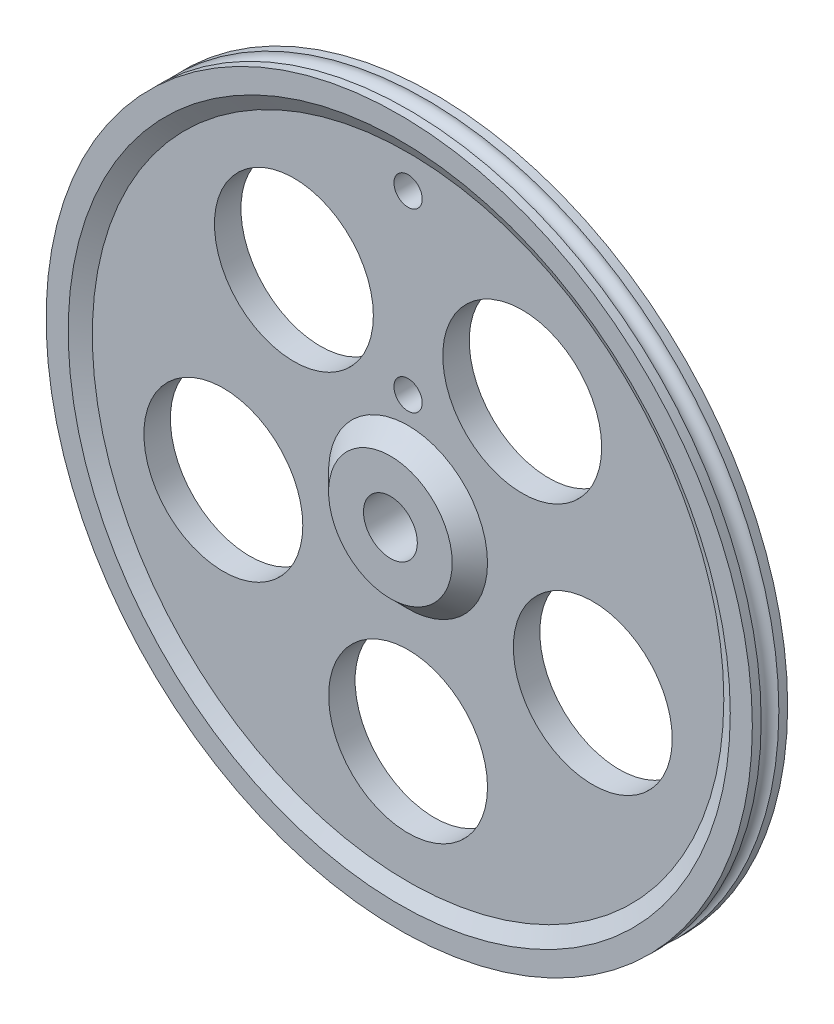
from build123d import *

# Parameters (mm, degrees)
SKETCH2_W          = 7
SKETCH2_H          = 1
SKETCH3_R          = 3.05
CUT_EXTRUDE1_DEPTH = 57.789083458
CHAMFER1_SIZE      = 2
SKETCH4_R          = 9
CUT_EXTRUDE2_DEPTH = 57.648036153
SKETCH5_R          = 1.6
CUT_EXTRUDE3_DEPTH = 57.789083458


with BuildPart() as part:
    # Sketch2 → Revolve1 (revolve)
    with BuildSketch(Plane(origin=(0, 0, 0), x_dir=(1, 0, 0), z_dir=(0, 1, 0))):
        with Locations((3.5, -2.5)):
            Rectangle(SKETCH2_W, SKETCH2_H)
        with BuildLine():
            Line((0, 2), (0, -2))
            Line((0, -2), (7, -2))
            Line((7, -2), (7, -1))
            Line((7, -1), (35.767949192, -1))
            Line((35.767949192, -1), (37.5, -2))
            Line((37.5, -2), (40, -2))
            Line((40, -2), (40, -1))
            ThreePointArc((40, -1), (39, 0), (40, 1))
            Line((40, 1), (40, 2))
            Line((40, 2), (0, 2))
        make_face()
    revolve(axis=Axis((0, 0, 2), (0, 0, -1)))

    # Sketch3 → Cut-Extrude1 (cut, through all)
    with BuildSketch(Plane.XY.offset(3)):
        Circle(SKETCH3_R)
    extrude(amount=-CUT_EXTRUDE1_DEPTH, mode=Mode.SUBTRACT)

    # Chamfer1
    chamfer1_edges = [part.edges().sort_by_distance(p)[0] for p in [
        (-7, 0, 1),
    ]]
    chamfer(chamfer1_edges, length=CHAMFER1_SIZE - 0.0001)  # a hair under: the kernel refuses the full size

    # Sketch4 → Cut-Extrude2 (cut, through all)
    with BuildSketch(Plane.XY.offset(1)):
        with Locations((0, -22)):
            Circle(SKETCH4_R)
        with Locations((-20.923243358, -6.798373876)):
            Circle(SKETCH4_R)
        with Locations((-12.93127555, 17.798373876)):
            Circle(SKETCH4_R)
        with Locations((12.93127555, 17.798373876)):
            Circle(SKETCH4_R)
        with Locations((20.923243358, -6.798373876)):
            Circle(SKETCH4_R)
    extrude(amount=-CUT_EXTRUDE2_DEPTH, mode=Mode.SUBTRACT)

    # Sketch5 → Cut-Extrude3 (cut, through all)
    with BuildSketch(Plane(origin=(0, 0, -2), x_dir=(-1, 0, 0), z_dir=(0, 0, -1))):
        with Locations((0, 12)):
            Circle(SKETCH5_R)
        with Locations((0, 32)):
            Circle(SKETCH5_R)
    extrude(amount=-CUT_EXTRUDE3_DEPTH, mode=Mode.SUBTRACT)


solid = part.part
